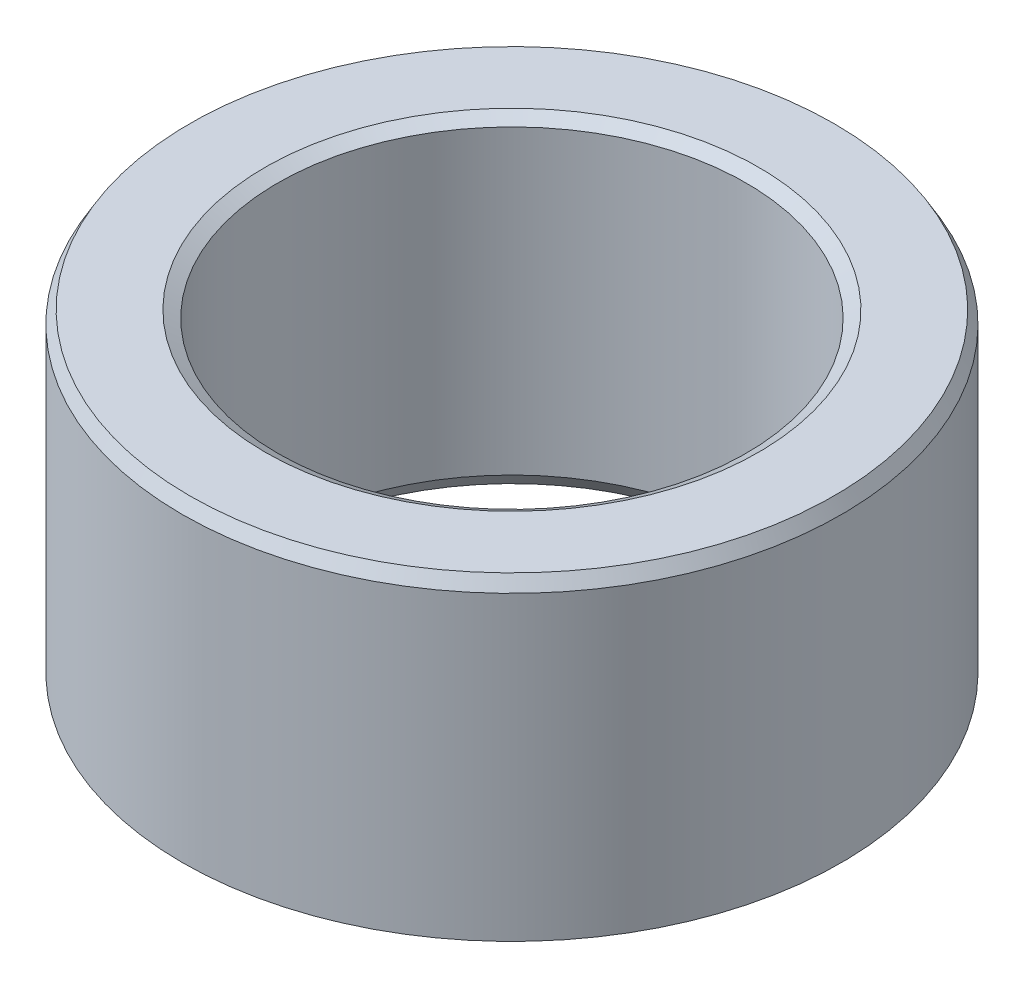
from build123d import *
from OCP.BRepFilletAPI import BRepFilletAPI_MakeChamfer

# Parameters (mm, degrees)
SKETCH1_R           = 60
BOSS_EXTRUDE1_DEPTH = 58.498574893
SKETCH2_R           = 42.638323008
CUT_EXTRUDE1_DEPTH  = 104.063491424
CHAMFER1_SIZE       = 2.29423371
CHAMFER1_SIZE2      = 1.32457645


with BuildPart() as part:
    # Sketch1 → Boss-Extrude1 (new body)
    with BuildSketch(Plane(origin=(0, 0, 0), x_dir=(1, 0, 0), z_dir=(0, 1, 0))):
        Circle(SKETCH1_R)
    extrude(amount=BOSS_EXTRUDE1_DEPTH)

    # Sketch2 → Cut-Extrude1 (cut, through all)
    with BuildSketch(Plane(origin=(0, 0, 0), x_dir=(1, 0, 0), z_dir=(0, 1, 0))):
        Circle(SKETCH2_R)
    extrude(amount=CUT_EXTRUDE1_DEPTH, mode=Mode.SUBTRACT)

    # Chamfer1: one chamfer whose edges measure the first distance from different faces: ONE call of the kernel's chamfer builder (chamfer() names one face for all edges)
    chamfer1_edges_1 = [part.edges().sort_by_distance(p)[0] for p in [
        (-42.638323008, 58.498574893, 0),
    ]]
    chamfer1_side_1 = [part.faces().sort_by_distance(p)[0] for p in [
        (-58.302943725, 58.498574893, 0),
    ]]
    chamfer1_edges_2 = [part.edges().sort_by_distance(p)[0] for p in [
        (-42.638323008, 0, 0),
    ]]
    chamfer1_side_2 = [part.faces().sort_by_distance(p)[0] for p in [
        (-42.638323008, 29.249287446, 0),
    ]]
    chamfer1_edges_3 = [part.edges().sort_by_distance(p)[0] for p in [
        (-60, 0, 0),
    ]]
    chamfer1_side_3 = [part.faces().sort_by_distance(p)[0] for p in [
        (-58.302943725, 0, 0),
    ]]
    chamfer1_edges_4 = [part.edges().sort_by_distance(p)[0] for p in [
        (-60, 58.498574893, 0),
    ]]
    chamfer1_side_4 = [part.faces().sort_by_distance(p)[0] for p in [
        (-60, 29.249287446, 0),
    ]]
    chamfer1 = BRepFilletAPI_MakeChamfer(part.part.solid().wrapped)
    for e in chamfer1_edges_1:
        chamfer1.Add(CHAMFER1_SIZE, CHAMFER1_SIZE2, e.wrapped, chamfer1_side_1[0].wrapped)  # the first distance lies on this face
    for e in chamfer1_edges_2:
        chamfer1.Add(CHAMFER1_SIZE, CHAMFER1_SIZE2, e.wrapped, chamfer1_side_2[0].wrapped)  # the first distance lies on this face
    for e in chamfer1_edges_3:
        chamfer1.Add(CHAMFER1_SIZE, CHAMFER1_SIZE2, e.wrapped, chamfer1_side_3[0].wrapped)  # the first distance lies on this face
    for e in chamfer1_edges_4:
        chamfer1.Add(CHAMFER1_SIZE, CHAMFER1_SIZE2, e.wrapped, chamfer1_side_4[0].wrapped)  # the first distance lies on this face
    add(Compound.cast(chamfer1.Shape()), mode=Mode.REPLACE)


solid = part.part
